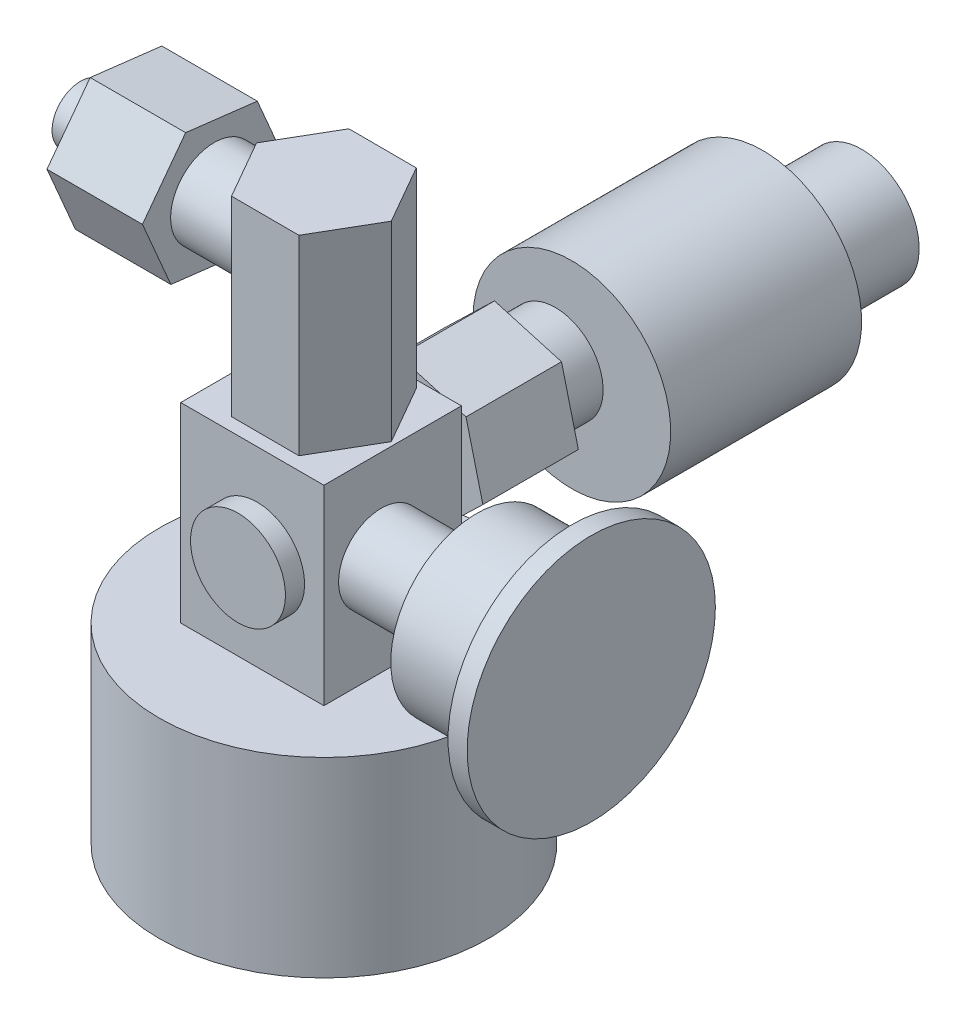
from build123d import *

# Parameters (mm, degrees)
SKETCH1_R                 = 21.9075
BOSS_EXTRUDE1_DEPTH       = 25.4
SKETCH2_W                 = 19.05
SKETCH2_H                 = 18.288
BOSS_EXTRUDE2_DEPTH       = 25.4
SKETCH4_R                 = 5.671096644
BOSS_EXTRUDE3_DEPTH       = 12.7
SKETCH3_R                 = 6.315658065
BOSS_EXTRUDE4_DEPTH       = 2.54
SKETCH5_R                 = 11.43
BOSS_EXTRUDE5_DEPTH       = 12.7
SKETCH6_R                 = 16.51
BOSS_EXTRUDE6_DEPTH       = 2.54
SKETCH7_R                 = 6.100778994
BOSS_EXTRUDE7_DEPTH       = 2.54
BOSS_EXTRUDE8_DEPTH       = 12.7
SKETCH9_R                 = 6.35
BOSS_EXTRUDE9_DEPTH       = 5.08
SKETCH10_R                = 13.144060193
BOSS_EXTRUDE10_DEPTH      = 25.4
SKETCH11_R                = 7.62
BOSS_EXTRUDE11_DEPTH      = 12.7
BOSS_EXTRUDE12_DEPTH      = 25.4
BOSS_EXTRUDE13_DEPTH      = 5.08
BOSS_EXTRUDE13_DEPTH_BACK = 5.08
SKETCH13_R                = 5.787549107
BOSS_EXTRUDE14_DEPTH      = 12.7
SKETCH15_R                = 3.774490797
BOSS_EXTRUDE15_DEPTH      = 5.08


with BuildPart() as part:
    # Sketch1 → Boss-Extrude1 (new body)
    with BuildSketch(Plane(origin=(0, 0, 0), x_dir=(1, 0, 0), z_dir=(0, 1, 0))):
        Circle(SKETCH1_R)
    extrude(amount=BOSS_EXTRUDE1_DEPTH)

    # Sketch2 → Boss-Extrude2 (add)
    with BuildSketch(Plane(origin=(0, 25.4, 0), x_dir=(1, 0, 0), z_dir=(0, 1, 0))):
        with Locations((0, -0.381)):
            Rectangle(SKETCH2_W, SKETCH2_H)
    extrude(amount=BOSS_EXTRUDE2_DEPTH)

    # Sketch4 → Boss-Extrude3 (add)
    with BuildSketch(Plane(origin=(9.525, 0, 0), x_dir=(0, 0, -1), z_dir=(1, 0, 0))):
        with Locations((-1.905, 38.66543371)):
            Circle(SKETCH4_R)
    extrude(amount=BOSS_EXTRUDE3_DEPTH)

    # Sketch3 → Boss-Extrude4 (add)
    with BuildSketch(Plane.XY.offset(9.525)):
        with Locations((0.635, 38.1)):
            Circle(SKETCH3_R)
    extrude(amount=BOSS_EXTRUDE4_DEPTH)

    # Sketch5 → Boss-Extrude5 (add)
    with BuildSketch(Plane(origin=(22.225, 0, 0), x_dir=(0, 0, -1), z_dir=(1, 0, 0))):
        with Locations((-1.905, 38.66543371)):
            Circle(SKETCH5_R)
    extrude(amount=BOSS_EXTRUDE5_DEPTH)

    # Sketch6 → Boss-Extrude6 (add)
    with BuildSketch(Plane(origin=(34.925, 0, 0), x_dir=(0, 0, -1), z_dir=(1, 0, 0))):
        with Locations((-1.905, 38.66543371)):
            Circle(SKETCH6_R)
    extrude(amount=BOSS_EXTRUDE6_DEPTH)

    # Sketch7 → Boss-Extrude7 (add)
    with BuildSketch(Plane(origin=(0, 0, -8.763), x_dir=(-1, 0, 0), z_dir=(0, 0, -1))):
        with Locations((0, 40.870731008)):
            Circle(SKETCH7_R)
    extrude(amount=BOSS_EXTRUDE7_DEPTH)

    # Sketch8 → Boss-Extrude8 (add)
    with BuildSketch(Plane(origin=(0, 0, -11.303), x_dir=(-1, 0, 0), z_dir=(0, 0, -1))):
        Polygon((7.972811549, 43.418132401), (1.306825994, 49.853379143), (-7.599253942, 47.298089682), (-9.839348323, 38.307553479), (-3.173362767, 31.872306737), (5.732717168, 34.427596198), align=None)
    extrude(amount=BOSS_EXTRUDE8_DEPTH)

    # Sketch9 → Boss-Extrude9 (add)
    with BuildSketch(Plane(origin=(0, 0, -24.003), x_dir=(-1, 0, 0), z_dir=(0, 0, -1))):
        with Locations((-1.705682249, 41.713755576)):
            Circle(SKETCH9_R)
    extrude(amount=BOSS_EXTRUDE9_DEPTH)

    # Sketch10 → Boss-Extrude10 (add)
    with BuildSketch(Plane(origin=(0, 0, -29.083), x_dir=(-1, 0, 0), z_dir=(0, 0, -1))):
        with Locations((-3.899814787, 41.405862228)):
            Circle(SKETCH10_R)
    extrude(amount=BOSS_EXTRUDE10_DEPTH)

    # Sketch11 → Boss-Extrude11 (add)
    with BuildSketch(Plane(origin=(0, 0, -54.483), x_dir=(-1, 0, 0), z_dir=(0, 0, -1))):
        with Locations((-4.369460548, 40.941133297)):
            Circle(SKETCH11_R)
    extrude(amount=BOSS_EXTRUDE11_DEPTH)

    # Sketch12 → Boss-Extrude12 (add)
    with BuildSketch(Plane(origin=(0, 50.8, 0), x_dir=(1, 0, 0), z_dir=(0, 1, 0))):
        Polygon((-4.517490101, -7.770885359), (4.47103908, -7.797703868), (8.988529181, -0.02681851), (4.517490101, 7.770885359), (-4.47103908, 7.797703868), (-8.988529181, 0.02681851), align=None)
    extrude(amount=BOSS_EXTRUDE12_DEPTH)

    # Sketch13 → Boss-Extrude13 (add, two sides: drawn at the far end of the back side and taken through both)
    with BuildSketch(Plane.ZY.offset(9.525).offset(-BOSS_EXTRUDE13_DEPTH_BACK)):
        with Locations((0, 67.654987394)):
            Circle(SKETCH13_R)
    extrude(amount=BOSS_EXTRUDE13_DEPTH + BOSS_EXTRUDE13_DEPTH_BACK)

    # Sketch14 → Boss-Extrude14 (add)
    with BuildSketch(Plane.ZY.offset(14.605)):
        Polygon((5.746959906, 59.966806486), (9.531639929, 68.787910214), (3.784680022, 76.476091122), (-5.746959906, 75.343168303), (-9.531639929, 66.522064575), (-3.784680022, 58.833883667), align=None)
    extrude(amount=BOSS_EXTRUDE14_DEPTH)

    # Sketch15 → Boss-Extrude15 (add)
    with BuildSketch(Plane.ZY.offset(27.305)):
        with Locations((0, 67.837228603)):
            Circle(SKETCH15_R)
    extrude(amount=BOSS_EXTRUDE15_DEPTH)


solid = part.part
